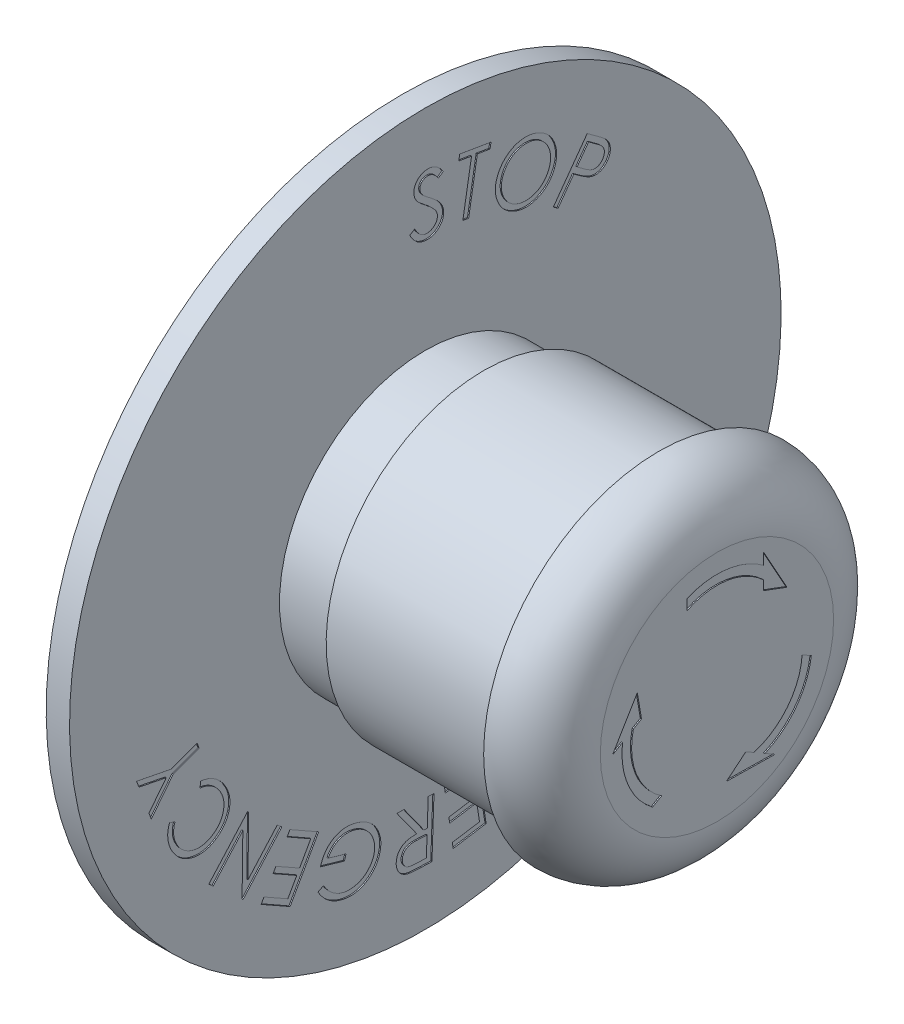
from build123d import *

# Parameters (mm, degrees)
RADYUS1_R             = 5
KES_EKSTR_ZYON1_DEPTH = 0.1
KES_EKSTR_ZYON2_DEPTH = 0.1


with BuildPart() as part:
    # Çizim1 → Döndür1 (revolve)
    with BuildSketch(Plane.XY):
        Polygon((0, 0), (0, 11), (5, 11), (5, 30.5), (7, 30.5), (7, 12.5), (12, 12.5), (12, 13.5), (27, 13.5), (27, 15), (32, 15), (32, 0), align=None)
    revolve(axis=Axis((32, 0, 0), (-1, 0, 0)))

    # Radyus1
    radyus1_edges = [part.edges().sort_by_distance(p)[0] for p in [
        (32, -15, 0),
    ]]
    fillet(radyus1_edges, radius=RADYUS1_R - 0.0001)  # a hair under: the kernel refuses the full size

    # Çizim2 → Kes-Ekstrüzyon1 (cut)
    # profile 1 of 13: a face of its own
    with BuildSketch(Plane(origin=(7, 0, 0), x_dir=(0, 0, -1), z_dir=(1, 0, 0))):
        with BuildLine():
            Line((13.875440561, 21.653815594), (14.673717805, 21.075890914))
            add(Edge.make_bspline(
                [(14.673717805, 21.075890914), (14.728630575, 21.036040467), (14.833696858, 20.959793387), (14.981725982, 20.847196558), (15.115349087, 20.744204034), (15.233588187, 20.649460799), (15.336063674, 20.562191341), (15.423327954, 20.483131095), (15.495883109, 20.41290824), (15.53667359, 20.366650583), (15.555128061, 20.345722645)],
                knots=[0, 0, 0, 0, 1.420122559, 2.71716396, 3.892737233, 4.951390436, 5.888266449, 6.709503759, 7.41615234, 8, 8, 8, 8], degree=3))
            add(Edge.make_bspline(
                [(15.555128061, 20.345722645), (15.577544188, 20.317972526), (15.622018046, 20.262915966), (15.681413349, 20.175943231), (15.731255338, 20.084929641), (15.774920383, 19.992304571), (15.808560758, 19.896068854), (15.836472092, 19.797954971), (15.853665659, 19.696148127), (15.865166308, 19.592828476), (15.867388135, 19.488194713), (15.859004148, 19.38398359), (15.842175548, 19.280310468), (15.814969079, 19.177221895), (15.776424647, 19.075348684), (15.72904773, 18.974025886), (15.673254989, 18.872818938), (15.628206513, 18.808862643), (15.60520819, 18.776211427)],
                knots=[0, 0, 0, 0, 1.005595454, 1.995113135, 2.964272848, 3.928758351, 4.878570321, 5.835446261, 6.801171256, 7.785616411, 8.764781792, 9.746658295, 10.729346678, 11.722573695, 12.747198682, 13.795843247, 14.874725353, 16, 16, 16, 16], degree=3))
            add(Edge.make_bspline(
                [(15.60520819, 18.776211427), (15.580944399, 18.744138355), (15.533136962, 18.680944133), (15.455231528, 18.594076982), (15.373703896, 18.51653411), (15.289213924, 18.447870995), (15.201062739, 18.388167526), (15.108142453, 18.339585742), (15.013167599, 18.297709138), (14.914288274, 18.266875476), (14.813697507, 18.245011991), (14.711498418, 18.231775441), (14.608242398, 18.22775154), (14.50380027, 18.233266931), (14.397763087, 18.245741171), (14.291232409, 18.269594276), (14.182699995, 18.300137785), (14.111930805, 18.328183507), (14.075761074, 18.342517517)],
                knots=[0, 0, 0, 0, 1.114330612, 2.195588104, 3.229768507, 4.22985257, 5.21026376, 6.17482532, 7.1323031, 8.083454903, 9.039993168, 9.982326305, 10.936175141, 11.899670788, 12.878727246, 13.891488876, 14.922351932, 16, 16, 16, 16], degree=3))
            add(Edge.make_bspline(
                [(14.075761074, 18.342517517), (14.046899176, 18.355225075), (13.983587555, 18.383100447), (13.88394331, 18.43588709), (13.770740456, 18.501099188), (13.644790397, 18.579931205), (13.504432407, 18.669726378), (13.351312294, 18.773153209), (13.185182838, 18.88970447), (13.070094875, 18.971777232), (13.010055946, 19.014592837)],
                knots=[0, 0, 0, 0, 0.599578484, 1.315238738, 2.142960671, 3.08388094, 4.140641364, 5.311733446, 6.597588838, 8, 8, 8, 8], degree=3))
            Line((13.010055946, 19.014592837), (12.724599215, 19.220922965))
            Line((12.724599215, 19.220922965), (11.376442164, 17.357942196))
            Line((11.376442164, 17.357942196), (10.975801138, 17.64840694))
            Line((10.975801138, 17.64840694), (13.875440561, 21.653815594))
        make_face()
        with BuildLine():
            Line((13.994631267, 20.974729055), (13.008052741, 19.612549568))
            Line((13.008052741, 19.612549568), (13.681129664, 19.113751491))
            add(Edge.make_bspline(
                [(13.681129664, 19.113751491), (13.714332739, 19.089778582), (13.778396912, 19.04352369), (13.873892174, 18.98104289), (13.96282474, 18.923722807), (14.04832627, 18.876669854), (14.126949769, 18.833497386), (14.201256886, 18.799972718), (14.269633853, 18.771692878), (14.354344435, 18.747155359), (14.456384648, 18.727631946), (14.577663984, 18.72667596), (14.696946093, 18.740534142), (14.812392387, 18.776907133), (14.922309673, 18.828319702), (15.023046965, 18.896451251), (15.115077622, 18.977958433), (15.165790098, 19.042772394), (15.191546331, 19.075690594)],
                knots=[0, 0, 0, 0, 1.140544921, 2.200641591, 3.178537646, 4.086353374, 4.918413495, 5.675762916, 6.356176007, 6.977038403, 8.129914713, 9.236748298, 10.342956598, 11.460869485, 12.592392984, 13.711813457, 14.837858689, 16, 16, 16, 16], degree=3))
            add(Edge.make_bspline(
                [(15.191546331, 19.075690594), (15.213958914, 19.109485074), (15.258384237, 19.176471134), (15.306272333, 19.286821339), (15.338082054, 19.40250141), (15.351111708, 19.522014825), (15.350271301, 19.641465556), (15.329536903, 19.757280932), (15.292693612, 19.867493525), (15.245798467, 19.954149463), (15.197325765, 20.021604629), (15.153764979, 20.077249987), (15.098459716, 20.133452469), (15.037119055, 20.195085656), (14.965305578, 20.257512884), (14.886071201, 20.324354853), (14.796955285, 20.392743711), (14.734226949, 20.438980743), (14.701762677, 20.462910145)],
                knots=[0, 0, 0, 0, 1.157859047, 2.295061659, 3.42308794, 4.576647722, 5.722595258, 6.82771859, 7.926803178, 9.033286866, 9.629344674, 10.301868682, 11.051572494, 11.882049563, 12.788377932, 13.771289952, 14.846558773, 16, 16, 16, 16], degree=3))
            Line((14.701762677, 20.462910145), (13.994631267, 20.974729055))
        make_face(mode=Mode.SUBTRACT)
    # profile 2 of 13: a face of its own
    with BuildSketch(Plane(origin=(7, 0, 0), x_dir=(0, 0, -1), z_dir=(1, 0, 0))):
        with BuildLine():
            add(Edge.make_bspline(
                [(9.573783751, 23.856418298), (9.658330874, 23.819899002), (9.824589632, 23.748085173), (10.057593508, 23.615471407), (10.272391116, 23.467404272), (10.466893449, 23.300276188), (10.640820877, 23.114765499), (10.796094877, 22.912272291), (10.93162577, 22.692101298), (11.045790322, 22.456570367), (11.138256996, 22.212605547), (11.206766353, 21.964617699), (11.246401866, 21.714670683), (11.26195372, 21.463708173), (11.250562268, 21.211282668), (11.213261687, 20.957911781), (11.149050281, 20.703280426), (11.087437056, 20.537261748), (11.056155545, 20.452972785)],
                knots=[0, 0, 0, 0, 1.066373157, 2.09698297, 3.100284276, 4.085009896, 5.061955223, 6.041439744, 7.036602347, 8.052118334, 9.069430342, 10.055674313, 11.027390471, 11.996184191, 12.964174433, 13.949416555, 14.958902969, 16, 16, 16, 16], degree=3))
            add(Edge.make_bspline(
                [(11.056155545, 20.452972785), (11.020556783, 20.371140491), (10.950464016, 20.210015454), (10.82148954, 19.983472242), (10.673449403, 19.776047799), (10.507397618, 19.586733769), (10.323431443, 19.415537175), (10.120638938, 19.263714507), (9.900115391, 19.130185349), (9.664798766, 19.015953379), (9.419572552, 18.924422439), (9.170978304, 18.85627312), (8.921078981, 18.816489136), (8.670806607, 18.800901758), (8.419640783, 18.811978831), (8.167970826, 18.850189674), (7.914691884, 18.911165272), (7.750293434, 18.97314979), (7.666732469, 19.004655477)],
                knots=[0, 0, 0, 0, 1.043051025, 2.053732427, 3.04180836, 4.01843218, 4.993650202, 5.975201759, 6.975581922, 8.004092273, 9.029530022, 10.032520111, 11.013310384, 11.983356378, 12.960385942, 13.947103291, 14.956547148, 16, 16, 16, 16], degree=3))
            add(Edge.make_bspline(
                [(7.666732469, 19.004655477), (7.583872241, 19.040535701), (7.420972778, 19.111074599), (7.19208951, 19.24160544), (6.982262844, 19.390088688), (6.790549628, 19.556067751), (6.618317922, 19.740380913), (6.465541757, 19.943165929), (6.33070326, 20.163389392), (6.217011006, 20.399272214), (6.124149009, 20.643427792), (6.056283302, 20.891252584), (6.014856398, 21.139611959), (5.999893773, 21.38835157), (6.010110782, 21.63731968), (6.045114121, 21.886771306), (6.107335971, 22.136463495), (6.16775496, 22.298776513), (6.19838311, 22.381057721)],
                knots=[0, 0, 0, 0, 1.056447776, 2.076928594, 3.077874161, 4.061422702, 5.040339639, 6.025285046, 7.028760875, 8.058362359, 9.086263598, 10.082773413, 11.061378196, 12.028551975, 12.99473808, 13.973647215, 14.972782621, 16, 16, 16, 16], degree=3))
            add(Edge.make_bspline(
                [(6.19838311, 22.381057721), (6.221344346, 22.435489534), (6.266949028, 22.543599803), (6.34801524, 22.698609757), (6.435738106, 22.847911108), (6.53448658, 22.988751838), (6.64066866, 23.123644571), (6.755892668, 23.250705926), (6.880038496, 23.370802873), (7.012373343, 23.482969797), (7.150963464, 23.587011552), (7.294953293, 23.68050866), (7.442986939, 23.763882153), (7.595615393, 23.835642767), (7.751449826, 23.898587162), (7.91217866, 23.949719635), (8.077348024, 23.98924627), (8.24550784, 24.019654001), (8.415168432, 24.038314218), (8.584468119, 24.046957721), (8.752722912, 24.042080718), (8.919815647, 24.028966107), (9.085699632, 24.002280052), (9.249981156, 23.965295143), (9.413321789, 23.917179709), (9.519937489, 23.87680802), (9.573783751, 23.856418298)],
                knots=[0, 0, 0, 0, 1.037437284, 2.060516038, 3.070446503, 4.077596923, 5.079730693, 6.08464127, 7.088455755, 8.112089191, 9.130314251, 10.130833254, 11.126094815, 12.112589827, 13.091751634, 14.076728491, 15.072542956, 16.073508857, 17.076826281, 18.069180042, 19.048974064, 20.031923067, 21.011646864, 21.997740752, 22.98875892, 24, 24, 24, 24], degree=3))
        make_face()
        with BuildLine():
            add(Edge.make_bspline(
                [(9.414528943, 23.396682721), (9.372000997, 23.412965044), (9.287230835, 23.445420295), (9.156995258, 23.483363247), (9.024634945, 23.511218549), (8.890885767, 23.531476336), (8.755359687, 23.54233282), (8.618135505, 23.544756033), (8.479374635, 23.535940487), (8.339474595, 23.520485202), (8.201028914, 23.495353477), (8.065536527, 23.462341865), (7.934288821, 23.421442955), (7.806860136, 23.371769884), (7.6832564, 23.314127341), (7.563660802, 23.247528088), (7.447879397, 23.173405182), (7.337271113, 23.090115363), (7.231248415, 23.000492885), (7.131626899, 22.903699595), (7.038498041, 22.8010043), (6.952950873, 22.690855531), (6.874113144, 22.574518236), (6.800300648, 22.452440496), (6.735464637, 22.322702445), (6.697380624, 22.233028026), (6.678150738, 22.187748426)],
                knots=[0, 0, 0, 0, 0.985089329, 1.963560198, 2.931331214, 3.910122072, 4.88864628, 5.87126887, 6.877120172, 7.89511779, 8.915419906, 9.919427489, 10.911091106, 11.887773447, 12.876749266, 13.859823228, 14.847769427, 15.849070225, 16.853649464, 17.849907604, 18.852458596, 19.851045271, 20.864958809, 21.892067178, 22.935634524, 24, 24, 24, 24], degree=3))
            add(Edge.make_bspline(
                [(6.678150738, 22.187748426), (6.652734652, 22.120084644), (6.60261382, 21.986650842), (6.552266158, 21.781663234), (6.521379864, 21.577807927), (6.512420414, 21.374704432), (6.524326828, 21.172251154), (6.558305751, 20.970810756), (6.610768349, 20.769724838), (6.686755323, 20.573015024), (6.77718916, 20.382941881), (6.884921893, 20.206000517), (7.006490767, 20.043786491), (7.142685646, 19.896346635), (7.293742235, 19.763913979), (7.45833708, 19.645179236), (7.638056289, 19.541938033), (7.765970891, 19.486541724), (7.830995289, 19.458381439)],
                knots=[0, 0, 0, 0, 1.05109651, 2.072775128, 3.064996378, 4.047426497, 5.02576314, 6.010641179, 7.015921565, 8.044646326, 9.074701197, 10.075462706, 11.054004429, 12.020152057, 12.990967534, 13.972616397, 14.969395241, 16, 16, 16, 16], degree=3))
            add(Edge.make_bspline(
                [(7.830995289, 19.458381439), (7.875525186, 19.441413416), (7.963999267, 19.407700556), (8.099376591, 19.368242571), (8.234984103, 19.336366835), (8.371730706, 19.31599618), (8.509114612, 19.302610336), (8.647683672, 19.298292757), (8.786802539, 19.305013946), (8.926013025, 19.318599838), (9.063577675, 19.341511016), (9.198183347, 19.373450106), (9.328753244, 19.415084817), (9.455816374, 19.4636282), (9.578621446, 19.521526131), (9.698042453, 19.585999539), (9.812757259, 19.661023923), (9.923266518, 19.743900471), (10.029658095, 19.833514084), (10.128207595, 19.931038485), (10.221788404, 20.033380725), (10.305841155, 20.144052235), (10.386007469, 20.259269855), (10.457722512, 20.381750209), (10.523199087, 20.510241187), (10.561204497, 20.599307292), (10.580394328, 20.644278875)],
                knots=[0, 0, 0, 0, 1.027023989, 2.040539263, 3.037586925, 4.02814351, 5.018726248, 6.012494568, 7.013975592, 8.019587091, 9.026640254, 10.018320823, 10.999522409, 11.979376498, 12.948677207, 13.924716558, 14.903035945, 15.900707022, 16.901644656, 17.899315734, 18.888066045, 19.888718928, 20.893015683, 21.912723494, 22.946084714, 24, 24, 24, 24], degree=3))
            add(Edge.make_bspline(
                [(10.580394328, 20.644278875), (10.597629431, 20.689828947), (10.631651363, 20.779744361), (10.672872091, 20.916903571), (10.704710982, 21.053760971), (10.728432589, 21.190806921), (10.741026974, 21.327777445), (10.745124094, 21.464597741), (10.740385684, 21.601182135), (10.725081709, 21.737346022), (10.700978907, 21.872091008), (10.669151199, 22.004737664), (10.627990806, 22.134286325), (10.57753033, 22.260512645), (10.519584811, 22.384270176), (10.451812866, 22.504762801), (10.376207967, 22.622991082), (10.290806774, 22.736231635), (10.200335174, 22.845625764), (10.103159936, 22.947183321), (10.001873331, 23.042381052), (9.894112927, 23.128225781), (9.782090397, 23.207734165), (9.664542064, 23.278884817), (9.542009121, 23.342386537), (9.457175162, 23.378518901), (9.414528943, 23.396682721)],
                knots=[0, 0, 0, 0, 1.053953129, 2.080493559, 3.097218726, 4.094023466, 5.088546435, 6.071820157, 7.055332869, 8.044141579, 9.035060763, 10.016633317, 10.994848054, 11.974503265, 12.957272259, 13.950507786, 14.964841533, 15.992500642, 17.018659426, 18.035898143, 19.0330172, 20.025095231, 21.01559268, 22.004639043, 22.996927629, 24, 24, 24, 24], degree=3))
        make_face(mode=Mode.SUBTRACT)
    # profile 3 of 13: a face of its own
    with BuildSketch(Plane(origin=(7, 0, 0), x_dir=(0, 0, -1), z_dir=(1, 0, 0))):
        Polygon((2.871163978, 25.123425076), (2.951292183, 25.598184691), (5.629577439, 25.144458729), (5.549449234, 24.669699114), (4.460707247, 24.853993986), (3.715514939, 20.447944306), (3.217718465, 20.532078922), (3.962910772, 24.938128601), align=None)
    # profile 4 of 13: a face of its own
    with BuildSketch(Plane(origin=(7, 0, 0), x_dir=(0, 0, -1), z_dir=(1, 0, 0))):
        with BuildLine():
            Line((-1.337153413, 21.708816777), (-0.911472323, 21.95621261))
            add(Edge.make_bspline(
                [(-0.911472323, 21.95621261), (-0.875563457, 21.890750301), (-0.806855081, 21.765494076), (-0.690149505, 21.596691687), (-0.569885352, 21.452570296), (-0.444198675, 21.333898914), (-0.313484202, 21.240207374), (-0.177417336, 21.172626811), (-0.036164164, 21.130676502), (0.060146657, 21.124136409), (0.108159087, 21.120876072)],
                knots=[0, 0, 0, 0, 1.293976273, 2.475906917, 3.552223758, 4.543433769, 5.465446695, 6.33021027, 7.167584049, 8, 8, 8, 8], degree=3))
            add(Edge.make_bspline(
                [(0.108159087, 21.120876072), (0.14930378, 21.121474475), (0.231109751, 21.12266425), (0.352012731, 21.143431063), (0.468883887, 21.178867609), (0.580721947, 21.227603437), (0.684156357, 21.2890569), (0.776330249, 21.361600619), (0.855472226, 21.44445128), (0.920287308, 21.537102909), (0.972489536, 21.635639005), (1.009608247, 21.738892142), (1.033691109, 21.84495585), (1.037657931, 21.917025348), (1.039649472, 21.953207803)],
                knots=[0, 0, 0, 0, 1.064815817, 2.117121001, 3.165187095, 4.222634588, 5.269950826, 6.273674184, 7.252603899, 8.22697535, 9.194256446, 10.132799985, 11.062573206, 12, 12, 12, 12], degree=3))
            add(Edge.make_bspline(
                [(1.039649472, 21.953207803), (1.038127092, 21.994800005), (1.035054419, 22.078746998), (1.002621023, 22.203636142), (0.952003239, 22.328019046), (0.902719555, 22.405283862), (0.877389857, 22.444994662)],
                knots=[0, 0, 0, 0, 0.94745069, 1.912272756, 2.926997804, 4, 4, 4, 4], degree=3))
            add(Edge.make_bspline(
                [(0.877389857, 22.444994662), (0.856725752, 22.473989475), (0.813353167, 22.534847662), (0.737473927, 22.624676727), (0.649834353, 22.718834939), (0.550847139, 22.817990473), (0.439103242, 22.920618623), (0.317034629, 23.029443797), (0.181703903, 23.141221755), (0.086303504, 23.215788434), (0.037045305, 23.254289534)],
                knots=[0, 0, 0, 0, 0.729634009, 1.531453345, 2.408067473, 3.366299189, 4.402687189, 5.5178448, 6.718385919, 8, 8, 8, 8], degree=3))
            add(Edge.make_bspline(
                [(0.037045305, 23.254289534), (-0.011773748, 23.292925511), (-0.105078506, 23.366768002), (-0.237540962, 23.473978601), (-0.355546024, 23.572299333), (-0.458117922, 23.663477569), (-0.547635745, 23.744260964), (-0.620514569, 23.819054093), (-0.680855891, 23.883588523), (-0.713430994, 23.926133486), (-0.728179054, 23.945395303)],
                knots=[0, 0, 0, 0, 1.445773492, 2.763215108, 3.957446637, 5.012120618, 5.950395544, 6.756326445, 7.436938951, 8, 8, 8, 8], degree=3))
            add(Edge.make_bspline(
                [(-0.728179054, 23.945395303), (-0.74868096, 23.974806092), (-0.789202179, 24.032935371), (-0.841198146, 24.124535738), (-0.885477593, 24.217904631), (-0.921781232, 24.312902389), (-0.948718771, 24.409562347), (-0.967994137, 24.507652429), (-0.979255546, 24.60751823), (-0.980139804, 24.67486791), (-0.9805829, 24.708616457)],
                knots=[0, 0, 0, 0, 1.051235077, 2.077725226, 3.085353131, 4.080336094, 5.057027011, 6.02508648, 7.010381908, 8, 8, 8, 8], degree=3))
            add(Edge.make_bspline(
                [(-0.9805829, 24.708616457), (-0.977984237, 24.761524346), (-0.972857526, 24.865902436), (-0.940843884, 25.018144159), (-0.890649808, 25.163243558), (-0.820198642, 25.299042127), (-0.733223226, 25.424811242), (-0.62892281, 25.537015907), (-0.508875247, 25.634643973), (-0.374650872, 25.716547448), (-0.229666718, 25.780989588), (-0.078060371, 25.829079845), (0.080525107, 25.855313756), (0.187862611, 25.858062073), (0.242373831, 25.859457803)],
                knots=[0, 0, 0, 0, 1.016936161, 2.006238705, 2.978469815, 3.960123806, 4.937530833, 5.909359392, 6.894656985, 7.90288836, 8.922696142, 9.937645741, 10.952635921, 12, 12, 12, 12], degree=3))
            add(Edge.make_bspline(
                [(0.242373831, 25.859457803), (0.300320297, 25.856754406), (0.414931266, 25.851407419), (0.583294637, 25.814626886), (0.745430916, 25.757661497), (0.874704215, 25.690920814), (0.975866288, 25.62593728), (1.053397469, 25.56719018), (1.131732603, 25.499343056), (1.211609383, 25.422727183), (1.29096109, 25.336357472), (1.372752653, 25.24198703), (1.454580683, 25.137758674), (1.507981549, 25.064036049), (1.535442741, 25.026124469)],
                knots=[0, 0, 0, 0, 1.299629766, 2.5705075, 3.84994491, 5.146526918, 5.823931031, 6.546083332, 7.326929883, 8.148129733, 9.028017791, 9.957559509, 10.949682755, 12, 12, 12, 12], degree=3))
            Line((1.535442741, 25.026124469), (1.125787292, 24.723640495))
            add(Edge.make_bspline(
                [(1.125787292, 24.723640495), (1.103233602, 24.753803007), (1.059758401, 24.811945209), (0.994577465, 24.894059899), (0.932576941, 24.968606414), (0.872554615, 25.034908866), (0.814507917, 25.092835449), (0.759461031, 25.143502125), (0.706512942, 25.185622018), (0.639707208, 25.230974946), (0.55593865, 25.276795184), (0.449778308, 25.314940189), (0.339338344, 25.339963007), (0.263540559, 25.343735004), (0.225346587, 25.345635687)],
                knots=[0, 0, 0, 0, 1.188487002, 2.290964754, 3.308127773, 4.247915986, 5.112138543, 5.895295386, 6.60779266, 7.244860526, 8.442280847, 9.608896613, 10.795139774, 12, 12, 12, 12], degree=3))
            add(Edge.make_bspline(
                [(0.225346587, 25.345635687), (0.177037166, 25.344576726), (0.08381948, 25.342533357), (-0.048882765, 25.307712791), (-0.169252835, 25.252535305), (-0.272115141, 25.172751665), (-0.358827212, 25.078463715), (-0.418893796, 24.968399405), (-0.459839791, 24.849000067), (-0.464419563, 24.764721354), (-0.466760784, 24.72163729)],
                knots=[0, 0, 0, 0, 1.109732321, 2.141335507, 3.135708597, 4.140232993, 5.120706462, 6.06425226, 7.01042772, 8, 8, 8, 8], degree=3))
            add(Edge.make_bspline(
                [(-0.466760784, 24.72163729), (-0.466392916, 24.694883338), (-0.465653325, 24.641095127), (-0.453014401, 24.561207374), (-0.43272472, 24.48247841), (-0.404742532, 24.403575631), (-0.363342166, 24.324590169), (-0.309541413, 24.242602032), (-0.240861516, 24.157961397), (-0.188673788, 24.101988213), (-0.161272002, 24.072598828)],
                knots=[0, 0, 0, 0, 0.868926279, 1.746956454, 2.62095216, 3.510247711, 4.46168786, 5.512336715, 6.693822894, 8, 8, 8, 8], degree=3))
            add(Edge.make_bspline(
                [(-0.161272002, 24.072598828), (-0.150988007, 24.06284465), (-0.126277749, 24.039407431), (-0.081148811, 24.000670856), (-0.02174712, 23.953035704), (0.05039297, 23.89455461), (0.136652246, 23.826591805), (0.23682717, 23.748483771), (0.35062423, 23.660605663), (0.431306172, 23.599126779), (0.473744023, 23.566789534)],
                knots=[0, 0, 0, 0, 0.418849765, 1.006407095, 1.756875763, 2.669124225, 3.750889701, 5.002237157, 6.423208303, 8, 8, 8, 8], degree=3))
            add(Edge.make_bspline(
                [(0.473744023, 23.566789534), (0.525019044, 23.526968727), (0.624441319, 23.449756177), (0.765550461, 23.333730063), (0.89434903, 23.221728823), (1.009728179, 23.112223075), (1.113242665, 23.006493147), (1.203443461, 22.903432805), (1.281010127, 22.80407074), (1.366762096, 22.679009941), (1.453194569, 22.523868861), (1.525238713, 22.334143309), (1.572005371, 22.144795884), (1.575689713, 22.017904607), (1.577510049, 21.955211008)],
                knots=[0, 0, 0, 0, 1.152416507, 2.234535781, 3.242560262, 4.181636036, 5.057603347, 5.868260394, 6.61158111, 7.293793832, 8.559082175, 9.752216833, 10.889430241, 12, 12, 12, 12], degree=3))
            add(Edge.make_bspline(
                [(1.577510049, 21.955211008), (1.57580034, 21.910721171), (1.572426209, 21.82291991), (1.550732665, 21.693991004), (1.516649749, 21.569723686), (1.468898986, 21.45022216), (1.41024815, 21.334517602), (1.336889131, 21.224612581), (1.251312443, 21.119060891), (1.154179301, 21.019492819), (1.049100496, 20.927242831), (0.936153617, 20.8482147), (0.818621085, 20.780072321), (0.694683887, 20.726346168), (0.566090446, 20.683627694), (0.431721607, 20.655049819), (0.292279944, 20.637171803), (0.197357554, 20.636460908), (0.149224792, 20.636100431)],
                knots=[0, 0, 0, 0, 0.988925146, 1.951656421, 2.898812225, 3.848436666, 4.807757292, 5.777330687, 6.780002897, 7.824518584, 8.866261742, 9.883524496, 10.884216877, 11.881241737, 12.881108032, 13.891442695, 14.930803513, 16, 16, 16, 16], degree=3))
            add(Edge.make_bspline(
                [(0.149224792, 20.636100431), (0.111789193, 20.637161037), (0.03769904, 20.639260122), (-0.071669397, 20.653010412), (-0.178571399, 20.672685554), (-0.282268814, 20.700859932), (-0.383512259, 20.736002581), (-0.48158525, 20.779595923), (-0.577903274, 20.829057981), (-0.670806036, 20.888043138), (-0.761430159, 20.955391526), (-0.849729533, 21.032885951), (-0.935778672, 21.120778192), (-1.021518305, 21.217554499), (-1.102588323, 21.326662674), (-1.184735446, 21.443559902), (-1.262270397, 21.572463176), (-1.311756605, 21.662572029), (-1.337153413, 21.708816777)],
                knots=[0, 0, 0, 0, 0.927651081, 1.835947947, 2.728505333, 3.619680932, 4.496333414, 5.381844337, 6.277464729, 7.177355815, 8.10574465, 9.073278569, 10.085493298, 11.152660921, 12.274683352, 13.452145097, 14.692415841, 16, 16, 16, 16], degree=3))
        make_face()
    # profile 5 of 13: a face of its own
    with BuildSketch(Plane(origin=(7, 0, 0), x_dir=(0, 0, -1), z_dir=(1, 0, 0))):
        Polygon((-23.490451635, -10.549296834), (-23.686765737, -10.012437859), (-22.206397147, -8.121412218), (-24.550147147, -7.653663821), (-24.747462853, -7.115803244), (-21.779714455, -7.699737539), (-19.557158365, -6.886436257), (-19.389890737, -7.345170231), (-21.612446827, -8.158471513), align=None)
    # profile 6 of 13: a face of its own
    with BuildSketch(Plane(origin=(7, 0, 0), x_dir=(0, 0, -1), z_dir=(1, 0, 0))):
        with BuildLine():
            Line((-21.925952273, -11.604151648), (-21.459205478, -11.766411263))
            add(Edge.make_bspline(
                [(-21.459205478, -11.766411263), (-21.484945989, -11.849704946), (-21.535783415, -12.014209701), (-21.575918431, -12.267437008), (-21.587534721, -12.5194986), (-21.56828551, -12.770061013), (-21.519117076, -13.017246636), (-21.439459124, -13.258949386), (-21.334165532, -13.496706155), (-21.241081244, -13.645121264), (-21.193780799, -13.720537866)],
                knots=[0, 0, 0, 0, 1.021698324, 2.017850907, 2.99800452, 3.976129078, 4.958596478, 5.947034203, 6.956792851, 8, 8, 8, 8], degree=3))
            add(Edge.make_bspline(
                [(-21.193780799, -13.720537866), (-21.165940455, -13.761002488), (-21.110632392, -13.841390138), (-21.018754508, -13.954066142), (-20.923093328, -14.061400929), (-20.818844369, -14.158830059), (-20.711197004, -14.252166377), (-20.595451827, -14.335565914), (-20.475021753, -14.413300912), (-20.349101004, -14.4829761), (-20.219847676, -14.545016736), (-20.088126616, -14.596930533), (-19.955885469, -14.640642641), (-19.821740079, -14.67318923), (-19.687129451, -14.698859098), (-19.550822864, -14.713535667), (-19.413640369, -14.719940668), (-19.275429425, -14.715536302), (-19.137593943, -14.702615289), (-19.000910449, -14.680872939), (-18.866221854, -14.648255576), (-18.733043554, -14.607251905), (-18.601279215, -14.557292209), (-18.471956594, -14.49638115), (-18.34345831, -14.427829317), (-18.260760847, -14.375137613), (-18.219021183, -14.348542674)],
                knots=[0, 0, 0, 0, 1.042050101, 2.07015302, 3.083547266, 4.091002901, 5.09633802, 6.105486858, 7.115829191, 8.137218977, 9.157821867, 10.156567347, 11.140318383, 12.111354111, 13.084249667, 14.046767373, 15.018500953, 15.99680081, 16.979019364, 17.955263967, 18.931508571, 19.917732084, 20.911336112, 21.919489293, 22.949909547, 24, 24, 24, 24], degree=3))
            add(Edge.make_bspline(
                [(-18.219021183, -14.348542674), (-18.158071689, -14.30592213), (-18.038529657, -14.222329206), (-17.876223274, -14.0795848), (-17.732178097, -13.926273974), (-17.607714057, -13.760938711), (-17.500179609, -13.585718709), (-17.412954243, -13.398418591), (-17.344926076, -13.199861515), (-17.295081043, -12.992629716), (-17.265323178, -12.780984226), (-17.255644883, -12.568926691), (-17.269057633, -12.359168858), (-17.303186856, -12.151025421), (-17.359713672, -11.945423397), (-17.43780955, -11.741682351), (-17.536580068, -11.539826321), (-17.617832991, -11.411137334), (-17.65912535, -11.345738186)],
                knots=[0, 0, 0, 0, 1.044308914, 2.048233698, 3.030622416, 3.995084931, 4.950838181, 5.914079285, 6.891696564, 7.895204804, 8.904234648, 9.890234218, 10.872533334, 11.851938414, 12.848813471, 13.862890127, 14.913930659, 16, 16, 16, 16], degree=3))
            add(Edge.make_bspline(
                [(-17.65912535, -11.345738186), (-17.708035401, -11.275798712), (-17.80438685, -11.138019878), (-17.973106489, -10.953918298), (-18.157711926, -10.794102249), (-18.356160035, -10.655235288), (-18.571117286, -10.54051306), (-18.801755573, -10.449618485), (-19.047410346, -10.380274304), (-19.217920615, -10.354339125), (-19.304758363, -10.341130815)],
                knots=[0, 0, 0, 0, 1.026936831, 2.023037211, 2.997745333, 3.96251808, 4.933861906, 5.924624892, 6.943049576, 8, 8, 8, 8], degree=3))
            Line((-19.304758363, -10.341130815), (-19.272707081, -9.848342353))
            add(Edge.make_bspline(
                [(-19.272707081, -9.848342353), (-19.222884542, -9.853430581), (-19.123851326, -9.863544548), (-18.977410729, -9.889030336), (-18.833218992, -9.922153594), (-18.691504958, -9.963719636), (-18.55248931, -10.01580178), (-18.415546317, -10.074493808), (-18.280848146, -10.141612243), (-18.14976399, -10.218127591), (-18.021450353, -10.302032092), (-17.897617145, -10.394284935), (-17.777480259, -10.493437152), (-17.663849327, -10.602268449), (-17.553165037, -10.717554387), (-17.44700547, -10.840782772), (-17.345512841, -10.972305628), (-17.282408491, -11.064635314), (-17.250471504, -11.111363186)],
                knots=[0, 0, 0, 0, 0.972923379, 1.933898447, 2.886007288, 3.846697626, 4.801168558, 5.768886781, 6.740836316, 7.723380793, 8.716640265, 9.718338797, 10.722597129, 11.741377216, 12.773802516, 13.827213395, 14.900356973, 16, 16, 16, 16], degree=3))
            add(Edge.make_bspline(
                [(-17.250471504, -11.111363186), (-17.221369557, -11.156526369), (-17.163912576, -11.245693604), (-17.085612717, -11.381866544), (-17.016770573, -11.51872928), (-16.953925777, -11.654978057), (-16.900411486, -11.791952525), (-16.853324229, -11.92863166), (-16.816993792, -12.066140838), (-16.78654252, -12.203359015), (-16.764063502, -12.340752494), (-16.751777153, -12.478654644), (-16.744846572, -12.616388688), (-16.748860336, -12.754472787), (-16.757889539, -12.892719284), (-16.778011978, -13.030924951), (-16.80294507, -13.169731179), (-16.827468543, -13.260952329), (-16.839814453, -13.306876007)],
                knots=[0, 0, 0, 0, 1.11712229, 2.205573227, 3.264326497, 4.301997074, 5.324342437, 6.321073482, 7.306277301, 8.279941179, 9.243253519, 10.198652941, 11.157627539, 12.108982497, 13.069564091, 14.03667157, 15.011596944, 16, 16, 16, 16], degree=3))
            add(Edge.make_bspline(
                [(-16.839814453, -13.306876007), (-16.863454773, -13.383162278), (-16.910259083, -13.534197719), (-17.004811068, -13.751169408), (-17.118045877, -13.956554302), (-17.250048233, -14.151119058), (-17.401055966, -14.334096814), (-17.570927311, -14.505366913), (-17.759297063, -14.66634922), (-17.896633409, -14.761695068), (-17.966617337, -14.810281456)],
                knots=[0, 0, 0, 0, 0.997452254, 1.974806738, 2.951448528, 3.924662115, 4.908673014, 5.911763782, 6.935875479, 8, 8, 8, 8], degree=3))
            add(Edge.make_bspline(
                [(-17.966617337, -14.810281456), (-18.042250886, -14.857457061), (-18.191156673, -14.95033543), (-18.42584985, -15.063165202), (-18.665186179, -15.148179701), (-18.90823517, -15.20940852), (-19.155760606, -15.243379991), (-19.407844157, -15.251283404), (-19.663886481, -15.232986608), (-19.920956911, -15.188559068), (-20.173808011, -15.12156368), (-20.416659003, -15.02973741), (-20.646977693, -14.915684823), (-20.863757694, -14.776669225), (-21.068485155, -14.616499679), (-21.259871985, -14.432233821), (-21.438972568, -14.225902497), (-21.544691382, -14.074127417), (-21.598428235, -13.996980174)],
                knots=[0, 0, 0, 0, 1.02891798, 2.025712729, 3.000153219, 3.957757252, 4.91529142, 5.87972543, 6.86539134, 7.874540932, 8.88839384, 9.881669965, 10.867999309, 11.850984322, 12.850631157, 13.865099756, 14.914830626, 16, 16, 16, 16], degree=3))
            add(Edge.make_bspline(
                [(-21.598428235, -13.996980174), (-21.629245985, -13.948503277), (-21.690059925, -13.852841815), (-21.772797062, -13.706159162), (-21.844848531, -13.557435265), (-21.90802446, -13.40774891), (-21.961102871, -13.256788426), (-22.005853934, -13.105196361), (-22.039404731, -12.951792943), (-22.06489285, -12.797721811), (-22.079545055, -12.643769315), (-22.085636717, -12.490961442), (-22.083079749, -12.339376253), (-22.069346392, -12.189315113), (-22.048880757, -12.040303717), (-22.017724384, -11.893053269), (-21.976365034, -11.747443425), (-21.942809108, -11.652065029), (-21.925952273, -11.604151648)],
                knots=[0, 0, 0, 0, 1.098041402, 2.166810465, 3.217279704, 4.25567721, 5.271065995, 6.274914979, 7.275267921, 8.271049475, 9.258615209, 10.229519782, 11.193476451, 12.154449152, 13.108529716, 14.067401742, 15.029158366, 16, 16, 16, 16], degree=3))
        make_face()
    # profile 7 of 13: a face of its own
    with BuildSketch(Plane(origin=(7, 0, 0), x_dir=(0, 0, -1), z_dir=(1, 0, 0))):
        Polygon((-12.302693126, -16.730958149), (-15.626010434, -20.459924495), (-15.707140241, -20.386807508), (-15.642036075, -15.323706546), (-18.186106588, -18.178273854), (-18.553694729, -17.850749815), (-15.230377421, -14.121783469), (-15.147244408, -14.195902059), (-15.199327741, -19.206919687), (-12.687308511, -16.387408469), align=None)
    # profile 8 of 13: a face of its own
    with BuildSketch(Plane(origin=(7, 0, 0), x_dir=(0, 0, -1), z_dir=(1, 0, 0))):
        Polygon((-11.592534921, -22.997108841), (-14.07250287, -21.593863649), (-13.831116652, -21.167180956), (-11.783841011, -22.32503352), (-11.018616652, -20.971868456), (-13.047863447, -19.824031918), (-12.808480434, -19.400354033), (-10.779233639, -20.548190572), (-9.81869678, -18.850474226), (-11.847943575, -17.702637687), (-11.606557357, -17.275954995), (-9.144618254, -18.669184161), align=None)
    # profile 9 of 13: a face of its own
    with BuildSketch(Plane(origin=(7, 0, 0), x_dir=(0, 0, -1), z_dir=(1, 0, 0))):
        with BuildLine():
            Line((-9.198479248, -23.120873464), (-8.725722838, -22.876482439))
            add(Edge.make_bspline(
                [(-8.725722838, -22.876482439), (-8.676476273, -22.958932773), (-8.579400058, -23.121461193), (-8.409575697, -23.345310435), (-8.22492118, -23.548887534), (-8.025026748, -23.729702457), (-7.814373246, -23.886512896), (-7.597864209, -24.018152868), (-7.377003663, -24.12482647), (-7.22461443, -24.174845918), (-7.149200402, -24.199599426)],
                knots=[0, 0, 0, 0, 1.092405057, 2.153379603, 3.191702762, 4.216735833, 5.216154451, 6.176122415, 7.097403714, 8, 8, 8, 8], degree=3))
            add(Edge.make_bspline(
                [(-7.149200402, -24.199599426), (-7.102268536, -24.212209552), (-7.008720562, -24.237344964), (-6.866497021, -24.264357427), (-6.723209482, -24.280876452), (-6.579431485, -24.290708543), (-6.434595593, -24.288747075), (-6.28932454, -24.280625884), (-6.143272183, -24.260713871), (-5.99728864, -24.233440514), (-5.853732938, -24.195955182), (-5.713865031, -24.152389816), (-5.579473742, -24.099444968), (-5.451271342, -24.036599529), (-5.327662714, -23.967901428), (-5.209762636, -23.890306236), (-5.097652775, -23.803865543), (-4.990899471, -23.71020163), (-4.891251297, -23.61015912), (-4.798392787, -23.506153303), (-4.715416486, -23.39649655), (-4.640332922, -23.283322331), (-4.572574958, -23.166503941), (-4.5132645, -23.045175409), (-4.463282846, -22.91906308), (-4.436323306, -22.8325944), (-4.422838222, -22.789343016)],
                knots=[0, 0, 0, 0, 1.026992677, 2.047075725, 3.056360304, 4.074586344, 5.090853973, 6.116123609, 7.14817164, 8.204238145, 9.253491552, 10.282422227, 11.299375729, 12.303093471, 13.29839007, 14.286857795, 15.28340461, 16.288535533, 17.28658054, 18.266496076, 19.23336425, 20.190499298, 21.135880277, 22.085912184, 23.042578801, 24, 24, 24, 24], degree=3))
            add(Edge.make_bspline(
                [(-4.422838222, -22.789343016), (-4.410872654, -22.744415356), (-4.386937506, -22.654544971), (-4.362176266, -22.517605518), (-4.347286953, -22.379697092), (-4.34097567, -22.241175151), (-4.345064064, -22.101581514), (-4.359399785, -21.961104187), (-4.382638694, -21.81966603), (-4.414053683, -21.677889427), (-4.456538619, -21.538331232), (-4.506140837, -21.401830245), (-4.565452528, -21.270292474), (-4.633954154, -21.143571815), (-4.711317377, -21.021145369), (-4.797388421, -20.902821018), (-4.892781989, -20.789678256), (-4.996237436, -20.681774117), (-5.105253422, -20.578597221), (-5.222390841, -20.484373135), (-5.344230062, -20.397602609), (-5.47111452, -20.317319421), (-5.604631738, -20.24706169), (-5.742784962, -20.182080107), (-5.887451993, -20.12734176), (-5.986509463, -20.096532864), (-6.036419953, -20.081009682)],
                knots=[0, 0, 0, 0, 0.954675029, 1.909670183, 2.85476567, 3.801998316, 4.755589047, 5.720431035, 6.700121711, 7.698309963, 8.700635412, 9.694290714, 10.679533717, 11.66138204, 12.650697542, 13.651990295, 14.664352552, 15.687779459, 16.721174748, 17.74503808, 18.772592095, 19.792428665, 20.826301657, 21.869457391, 22.926517854, 24, 24, 24, 24], degree=3))
            add(Edge.make_bspline(
                [(-6.036419953, -20.081009682), (-6.097274732, -20.064568671), (-6.216663426, -20.032313671), (-6.397192392, -20.003137089), (-6.573555269, -19.986413525), (-6.747218265, -19.985096659), (-6.917546492, -20.000190458), (-7.084610985, -20.030798932), (-7.248628867, -20.074260804), (-7.407120822, -20.134828166), (-7.558709173, -20.207286927), (-7.701019255, -20.291879954), (-7.832805577, -20.388130942), (-7.953275551, -20.496846754), (-8.062965409, -20.616572321), (-8.1616809, -20.74761732), (-8.249236918, -20.890366988), (-8.298235004, -20.992012306), (-8.323078607, -21.043549746)],
                knots=[0, 0, 0, 0, 1.111741437, 2.181083592, 3.222317244, 4.235724676, 5.241222801, 6.235105714, 7.22984397, 8.231121365, 9.224602536, 10.191594603, 11.148482359, 12.099675766, 13.050467649, 14.009656251, 14.990831816, 16, 16, 16, 16], degree=3))
            Line((-8.323078607, -21.043549746), (-6.796636299, -21.483253272))
            Line((-6.796636299, -21.483253272), (-6.92984944, -21.944992054))
            Line((-6.92984944, -21.944992054), (-8.993150722, -21.350040131))
            add(Edge.make_bspline(
                [(-8.993150722, -21.350040131), (-8.96444612, -21.260756577), (-8.908306646, -21.086138875), (-8.803288738, -20.837860061), (-8.680408249, -20.610691526), (-8.543192257, -20.402478176), (-8.388158011, -20.215298561), (-8.217099313, -20.048329619), (-8.030559138, -19.900544302), (-7.828258213, -19.77505323), (-7.614409116, -19.670472039), (-7.390780452, -19.591324556), (-7.159521071, -19.535611435), (-6.920453466, -19.504984193), (-6.673139168, -19.497803101), (-6.418424779, -19.517003915), (-6.155372576, -19.558378215), (-5.98063241, -19.60527944), (-5.891187581, -19.629286926)],
                knots=[0, 0, 0, 0, 1.124189947, 2.198652024, 3.226816629, 4.217228363, 5.183949677, 6.135161803, 7.078634145, 8.031731461, 8.984256881, 9.927593317, 10.870428433, 11.831271401, 12.812489614, 13.831887735, 14.890201173, 16, 16, 16, 16], degree=3))
            add(Edge.make_bspline(
                [(-5.891187581, -19.629286926), (-5.836612567, -19.645841015), (-5.729074771, -19.67846016), (-5.572342363, -19.734980499), (-5.421793806, -19.796466348), (-5.278617084, -19.866245864), (-5.141223312, -19.940335963), (-5.009223021, -20.019276868), (-4.884534486, -20.105472125), (-4.765790441, -20.196991588), (-4.652982277, -20.293857846), (-4.548695025, -20.398603836), (-4.44832127, -20.506939152), (-4.35535886, -20.622079052), (-4.269416115, -20.743610349), (-4.18902163, -20.870196757), (-4.114313436, -21.002229443), (-4.071029805, -21.094337324), (-4.049240466, -21.140705195)],
                knots=[0, 0, 0, 0, 1.110915376, 2.189012536, 3.244744382, 4.277503852, 5.290304236, 6.285341283, 7.272245161, 8.241500389, 9.205239983, 10.166518026, 11.119485789, 12.081489765, 13.047071404, 14.017874981, 15.002181824, 16, 16, 16, 16], degree=3))
            add(Edge.make_bspline(
                [(-4.049240466, -21.140705195), (-4.018585102, -21.212667644), (-3.957909343, -21.355101974), (-3.889944651, -21.57548235), (-3.84294226, -21.797131806), (-3.815227143, -22.02030635), (-3.809260435, -22.244712953), (-3.825010566, -22.470532177), (-3.859390336, -22.697958178), (-3.898320039, -22.847727885), (-3.91803053, -22.923557759)],
                knots=[0, 0, 0, 0, 1.027104474, 2.032934407, 3.023975107, 4.000544428, 4.983417365, 5.968138351, 6.971248475, 8, 8, 8, 8], degree=3))
            add(Edge.make_bspline(
                [(-3.91803053, -22.923557759), (-3.935221289, -22.979607918), (-3.969290531, -23.090690067), (-4.034880054, -23.251310903), (-4.107135405, -23.40735127), (-4.192077851, -23.556239962), (-4.284772856, -23.700095986), (-4.3889823, -23.836711425), (-4.502063348, -23.968120167), (-4.624563145, -24.092568891), (-4.754995916, -24.208629206), (-4.890851917, -24.316215773), (-5.033288168, -24.412400894), (-5.181570577, -24.497690723), (-5.334409396, -24.574154057), (-5.493572006, -24.639301371), (-5.65819077, -24.694480853), (-5.827815828, -24.739297431), (-6.001052447, -24.773578347), (-6.1767635, -24.795568465), (-6.354465223, -24.805673453), (-6.534105505, -24.803225894), (-6.715790934, -24.790475274), (-6.899407151, -24.765103465), (-7.085018805, -24.728147653), (-7.208129627, -24.695086501), (-7.270394312, -24.678365452)],
                knots=[0, 0, 0, 0, 0.999212209, 1.980273414, 2.955668965, 3.929451589, 4.900584551, 5.871834317, 6.856753245, 7.855137975, 8.847041417, 9.83220712, 10.808034548, 11.77475203, 12.747335701, 13.71998602, 14.704756854, 15.705913372, 16.709656445, 17.713786926, 18.723068645, 19.742193194, 20.77529469, 21.826804788, 22.900882052, 24, 24, 24, 24], degree=3))
            add(Edge.make_bspline(
                [(-7.270394312, -24.678365452), (-7.320628039, -24.663141809), (-7.420498303, -24.632875507), (-7.566501739, -24.579540421), (-7.708488582, -24.52061083), (-7.845300257, -24.453934439), (-7.979238569, -24.383177213), (-8.108608852, -24.304854198), (-8.233218886, -24.219700635), (-8.354726988, -24.129099951), (-8.47154074, -24.030892402), (-8.585546637, -23.925268177), (-8.695482977, -23.810879655), (-8.802360037, -23.688568566), (-8.907256624, -23.559061665), (-9.007898413, -23.420600033), (-9.106561273, -23.274720237), (-9.1675784, -23.172593444), (-9.198479248, -23.120873464)],
                knots=[0, 0, 0, 0, 0.98992812, 1.968087756, 2.930655017, 3.888327364, 4.837785444, 5.787139089, 6.739100138, 7.683742322, 8.644887054, 9.616313237, 10.613963519, 11.635905514, 12.679429938, 13.756395681, 14.863773498, 16, 16, 16, 16], degree=3))
        make_face()
    # profile 10 of 13: a face of its own
    with BuildSketch(Plane(origin=(7, 0, 0), x_dir=(0, 0, -1), z_dir=(1, 0, 0))):
        with BuildLine():
            Line((0.570046386, -25.738662024), (-0.42053855, -25.703605934))
            add(Edge.make_bspline(
                [(-0.42053855, -25.703605934), (-0.486654395, -25.701156158), (-0.613585438, -25.696453009), (-0.79553046, -25.686197081), (-0.960815367, -25.675305396), (-1.10945854, -25.663577277), (-1.241452798, -25.649982545), (-1.356583921, -25.633659112), (-1.45514585, -25.617808798), (-1.514360744, -25.603123355), (-1.541331819, -25.59643446)],
                knots=[0, 0, 0, 0, 1.408149712, 2.703405073, 3.87850918, 4.933658782, 5.876920897, 6.701990322, 7.408785282, 8, 8, 8, 8], degree=3))
            add(Edge.make_bspline(
                [(-1.541331819, -25.59643446), (-1.577265021, -25.58603422), (-1.648059331, -25.565544039), (-1.74940037, -25.524508049), (-1.846430436, -25.478881458), (-1.937477293, -25.424640431), (-2.023036003, -25.363066041), (-2.103440636, -25.295070622), (-2.177721418, -25.219260248), (-2.246793883, -25.137536779), (-2.308644942, -25.049840431), (-2.362265852, -24.957121025), (-2.406315335, -24.8597448), (-2.441397221, -24.75771403), (-2.468598494, -24.651583362), (-2.48648983, -24.540646067), (-2.495792585, -24.425385297), (-2.494508099, -24.347115902), (-2.493855857, -24.30737196)],
                knots=[0, 0, 0, 0, 1.031151241, 2.031537323, 3.011843003, 3.986291915, 4.949756949, 5.916648663, 6.886911254, 7.873812587, 8.865129417, 9.842879788, 10.823747607, 11.808110754, 12.815424098, 13.841876836, 14.904139691, 16, 16, 16, 16], degree=3))
            add(Edge.make_bspline(
                [(-2.493855857, -24.30737196), (-2.489282426, -24.241702583), (-2.480348325, -24.113418863), (-2.437406595, -23.928646509), (-2.37191644, -23.756731903), (-2.282413201, -23.599043733), (-2.171160411, -23.457002578), (-2.038313786, -23.334665597), (-1.885801123, -23.232421079), (-1.743855927, -23.164772333), (-1.619806949, -23.119169861), (-1.516522547, -23.092409006), (-1.405857064, -23.067406906), (-1.286595076, -23.050225931), (-1.158954907, -23.037103635), (-1.023269606, -23.029434586), (-0.879275368, -23.026277599), (-0.780780406, -23.02829017), (-0.730033742, -23.029327088)],
                knots=[0, 0, 0, 0, 1.274473834, 2.489657324, 3.661550533, 4.829577041, 5.99098619, 7.145159526, 8.315532641, 9.537093647, 10.184042627, 10.874859393, 11.603536181, 12.382474501, 13.208723558, 14.09044785, 15.016158813, 16, 16, 16, 16], degree=3))
            Line((-0.730033742, -23.029327088), (-2.436764511, -20.654527409))
            Line((-2.436764511, -20.654527409), (-1.821780537, -20.675561063))
            Line((-1.821780537, -20.675561063), (-0.118054575, -23.051362345))
            Line((-0.118054575, -23.051362345), (0.166400553, -23.06137837))
            Line((0.166400553, -23.06137837), (0.247530361, -20.74867805))
            Line((0.247530361, -20.74867805), (0.744325232, -20.765705293))
            Line((0.744325232, -20.765705293), (0.570046386, -25.738662024))
        make_face()
        with BuildLine():
            Line((0.090278758, -25.234855934), (0.149373309, -23.544150806))
            Line((0.149373309, -23.544150806), (-0.70599528, -23.507091511))
            add(Edge.make_bspline(
                [(-0.70599528, -23.507091511), (-0.746056032, -23.505747809), (-0.823496629, -23.503150325), (-0.935714546, -23.504942827), (-1.039960882, -23.507162559), (-1.136279319, -23.513896345), (-1.224650928, -23.525614843), (-1.305527363, -23.537499209), (-1.378055186, -23.554808807), (-1.462784445, -23.581047673), (-1.558759433, -23.622975707), (-1.662306044, -23.68834348), (-1.752224144, -23.769938981), (-1.829533831, -23.863929158), (-1.891033221, -23.969115567), (-1.938045382, -24.081416224), (-1.967657565, -24.201107916), (-1.973870268, -24.283507279), (-1.977028934, -24.325400806)],
                knots=[0, 0, 0, 0, 1.116636583, 2.158546722, 3.12639857, 4.02179971, 4.846781372, 5.609918289, 6.298107177, 6.92185362, 8.079843423, 9.204972249, 10.318193796, 11.44854046, 12.582861041, 13.700582038, 14.830928702, 16, 16, 16, 16], degree=3))
            add(Edge.make_bspline(
                [(-1.977028934, -24.325400806), (-1.977025531, -24.366238393), (-1.977018782, -24.447233676), (-1.953609469, -24.565939412), (-1.915440218, -24.679709367), (-1.86063213, -24.786638897), (-1.790308218, -24.882814389), (-1.710254547, -24.968890837), (-1.616593085, -25.037912636), (-1.530059912, -25.08515435), (-1.452117392, -25.115403878), (-1.383720419, -25.135270693), (-1.306178484, -25.151499906), (-1.219880105, -25.168178859), (-1.124205112, -25.180662897), (-1.019276047, -25.190469413), (-0.905391395, -25.19848088), (-0.826197464, -25.201987482), (-0.785121883, -25.203806255)],
                knots=[0, 0, 0, 0, 1.158049436, 2.296818906, 3.418867787, 4.560242507, 5.695092886, 6.79559772, 7.886615443, 8.986015619, 9.586782733, 10.259230849, 11.007330279, 11.837222026, 12.756297346, 13.747507468, 14.831697859, 16, 16, 16, 16], degree=3))
            Line((-0.785121883, -25.203806255), (0.090278758, -25.234855934))
        make_face(mode=Mode.SUBTRACT)
    # profile 11 of 13: a face of its own
    with BuildSketch(Plane(origin=(7, 0, 0), x_dir=(0, 0, -1), z_dir=(1, 0, 0))):
        Polygon((5.215395422, -25.233927703), (2.391877794, -25.676636036), (2.315755999, -25.190858792), (4.647486768, -24.825273856), (4.40610055, -23.284809113), (2.094401832, -23.647389241), (2.018280037, -23.164616805), (4.329978755, -22.802036677), (4.027494781, -20.869945331), (1.715796063, -21.232525459), (1.639674268, -20.746748215), (4.443159845, -20.30704469), align=None)
    # profile 12 of 13: a face of its own
    with BuildSketch(Plane(origin=(7, 0, 0), x_dir=(0, 0, -1), z_dir=(1, 0, 0))):
        Polygon((10.526140645, -17.91479674), (11.799177504, -22.793602829), (11.724057312, -22.824652509), (8.270531671, -19.829860842), (7.999097376, -24.383146099), (7.923977183, -24.415197381), (5.33683776, -20.086271099), (5.790563722, -19.896968214), (7.619490004, -23.001936163), (7.868889042, -19.027577188), (7.984073337, -18.979500265), (11.021933914, -21.606703791), (10.081429106, -18.101094817), align=None)
    # profile 13 of 13: a face of its own
    with BuildSketch(Plane(origin=(7, 0, 0), x_dir=(0, 0, -1), z_dir=(1, 0, 0))):
        Polygon((16.345081992, -19.923722257), (14.049408915, -21.629451424), (13.755939364, -21.234820014), (15.650971415, -19.827568411), (14.720482633, -18.574563604), (12.841476223, -19.969795975), (12.550009877, -19.578169373), (14.429016287, -18.182937001), (13.2621493, -16.611422578), (11.38314289, -18.00665495), (11.089673338, -17.61202354), (13.369320774, -15.918313604), align=None)
    extrude(amount=-KES_EKSTR_ZYON1_DEPTH, mode=Mode.SUBTRACT)

    # Çizim3 → Kes-Ekstrüzyon2 (cut)
    with BuildSketch(Plane(origin=(32, 0, 0), x_dir=(0, 0, -1), z_dir=(1, 0, 0))):
        with BuildLine():
            Line((-2.563071431, 7.861129646), (-2.563071431, 6.954629709))
            ThreePointArc((-2.563071431, 6.954629709), (0.867752406, 7.483506), (3.990734463, 5.967839346))
            Line((3.990734463, 5.967839346), (3.990734463, 5.16401255))
            Line((3.990734463, 5.16401255), (6.006163081, 4.412134964))
            Line((6.006163081, 4.412134964), (3.990734463, 8.039906477))
            Line((3.990734463, 8.039906477), (3.990734463, 7.045069489))
            ThreePointArc((3.990734463, 7.045069489), (0.822218935, 8.323562491), (-2.563071431, 7.861129646))
        make_face()
        with BuildLine():
            Line((8.089473691, -1.710879851), (7.304421718, -1.257629883))
            ThreePointArc((7.304421718, -1.257629883), (6.047030102, -4.493248627), (3.172933248, -6.439997098))
            Line((3.172933248, -6.439997098), (2.476798823, -6.038083699))
            Line((2.476798823, -6.038083699), (0.817939424, -7.40755729))
            Line((0.817939424, -7.40755729), (4.967396022, -7.476030663))
            Line((4.967396022, -7.476030663), (4.105841917, -6.978612169))
            ThreePointArc((4.105841917, -6.978612169), (6.797307099, -4.873843731), (8.089473691, -1.710879851))
        make_face()
        with BuildLine():
            Line((-5.52640226, -6.150249794), (-4.741350286, -5.696999826))
            ThreePointArc((-4.741350286, -5.696999826), (-6.914782508, -2.990257372), (-7.163667711, 0.472157751))
            Line((-7.163667711, 0.472157751), (-6.467533285, 0.874071149))
            Line((-6.467533285, 0.874071149), (-6.824102505, 2.995422325))
            Line((-6.824102505, 2.995422325), (-8.958130485, -0.563875814))
            Line((-8.958130485, -0.563875814), (-8.09657638, -0.06645732))
            ThreePointArc((-8.09657638, -0.06645732), (-7.619526035, -3.44971876), (-5.52640226, -6.150249794))
        make_face()
    extrude(amount=-KES_EKSTR_ZYON2_DEPTH, mode=Mode.SUBTRACT)


solid = part.part
